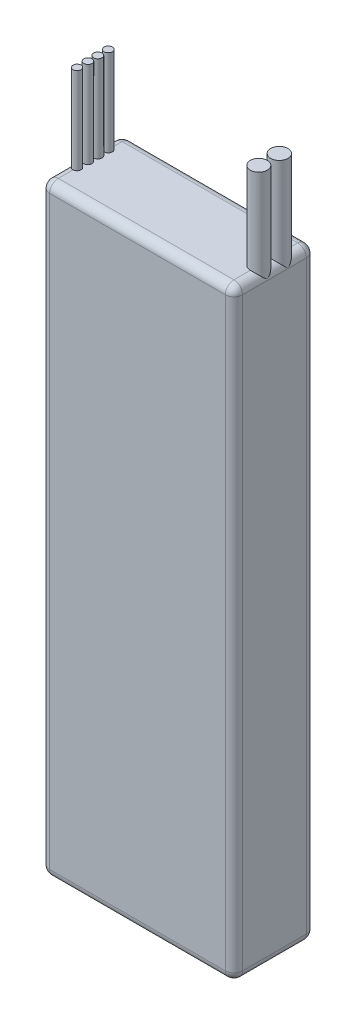
from build123d import *

# Parameters (mm, degrees)
SKETCH1_W                       = 44.5
SKETCH1_H                       = 18.7
BOSS_EXTRUDE1_DEPTH             = 139
FILLET1_R                       = 2
SKETCH2_R                       = 1.960015311
SKETCH2_R_2                     = 1.988264752
SKETCH2_R_3                     = 0.918642691
SKETCH2_R_4                     = 0.97117112
SKETCH2_R_5                     = 0.953860003
SKETCH2_R_6                     = 0.951024876
BOSS_EXTRUDE2_DEPTH             = 20
BOSS_EXTRUDE2_DIRECTION_2_REACH = 149.143


with BuildPart() as part:
    # Sketch1 → Boss-Extrude1 (new body)
    with BuildSketch(Plane(origin=(0, 0, 0), x_dir=(1, 0, 0), z_dir=(0, 1, 0))):
        with Locations((22.25, 9.35)):
            Rectangle(SKETCH1_W, SKETCH1_H)
    extrude(amount=BOSS_EXTRUDE1_DEPTH)

    # Fillet1
    fillet1_edges = [part.edges().sort_by_distance(p)[0] for p in [
        (22.25, 0, -18.7),
        (0, 69.5, -18.7),
        (0, 0, -9.35),
        (22.25, 139, -18.7),
        (0, 139, -9.35),
        (44.5, 139, -9.35),
        (44.5, 69.5, -18.7),
        (44.5, 0, -9.35),
        (0, 69.5, 0),
        (22.25, 139, 0),
        (44.5, 69.5, 0),
        (22.25, 0, 0),
    ]]
    fillet(fillet1_edges, radius=FILLET1_R)

    # Sketch2 → Boss-Extrude2 (add)
    with BuildSketch(Plane(origin=(0, 139, 0), x_dir=(1, 0, 0), z_dir=(0, 1, 0))):
        with Locations((42.5, 7.731273805)):
            Circle(SKETCH2_R)
        with Locations((42.5, 12.467660333)):
            Circle(SKETCH2_R_2)
        with Locations((2, 6.327900019)):
            Circle(SKETCH2_R_3)
        with Locations((2, 11.108141978)):
            Circle(SKETCH2_R_4)
        with Locations((2, 13.520190672)):
            Circle(SKETCH2_R_5)
        with Locations((2, 8.827659575)):
            Circle(SKETCH2_R_6)
    extrude(amount=BOSS_EXTRUDE2_DEPTH)

    # Sketch2 → Boss-Extrude2 direction 2 (add, up to next)
    with BuildSketch(Plane(origin=(0, 139, 0), x_dir=(1, 0, 0), z_dir=(0, 1, 0)), mode=Mode.PRIVATE) as boss_extrude2_direction_2_sk1:
        with Locations((42.5, 7.731273805)):
            Circle(SKETCH2_R)
    boss_extrude2_direction_2_tool1 = extrude(boss_extrude2_direction_2_sk1.sketch, amount=-BOSS_EXTRUDE2_DIRECTION_2_REACH, mode=Mode.PRIVATE) - part.part
    # Sketch2 → Boss-Extrude2 direction 2 (add, up to next)
    with BuildSketch(Plane(origin=(0, 139, 0), x_dir=(1, 0, 0), z_dir=(0, 1, 0)), mode=Mode.PRIVATE) as boss_extrude2_direction_2_sk2:
        with Locations((42.5, 12.467660333)):
            Circle(SKETCH2_R_2)
    boss_extrude2_direction_2_tool2 = extrude(boss_extrude2_direction_2_sk2.sketch, amount=-BOSS_EXTRUDE2_DIRECTION_2_REACH, mode=Mode.PRIVATE) - part.part
    # Sketch2 → Boss-Extrude2 direction 2 (add, up to next)
    with BuildSketch(Plane(origin=(0, 139, 0), x_dir=(1, 0, 0), z_dir=(0, 1, 0)), mode=Mode.PRIVATE) as boss_extrude2_direction_2_sk3:
        with Locations((2, 6.327900019)):
            Circle(SKETCH2_R_3)
    boss_extrude2_direction_2_tool3 = extrude(boss_extrude2_direction_2_sk3.sketch, amount=-BOSS_EXTRUDE2_DIRECTION_2_REACH, mode=Mode.PRIVATE) - part.part
    # Sketch2 → Boss-Extrude2 direction 2 (add, up to next)
    with BuildSketch(Plane(origin=(0, 139, 0), x_dir=(1, 0, 0), z_dir=(0, 1, 0)), mode=Mode.PRIVATE) as boss_extrude2_direction_2_sk4:
        with Locations((2, 11.108141978)):
            Circle(SKETCH2_R_4)
    boss_extrude2_direction_2_tool4 = extrude(boss_extrude2_direction_2_sk4.sketch, amount=-BOSS_EXTRUDE2_DIRECTION_2_REACH, mode=Mode.PRIVATE) - part.part
    # Sketch2 → Boss-Extrude2 direction 2 (add, up to next)
    with BuildSketch(Plane(origin=(0, 139, 0), x_dir=(1, 0, 0), z_dir=(0, 1, 0)), mode=Mode.PRIVATE) as boss_extrude2_direction_2_sk5:
        with Locations((2, 13.520190672)):
            Circle(SKETCH2_R_5)
    boss_extrude2_direction_2_tool5 = extrude(boss_extrude2_direction_2_sk5.sketch, amount=-BOSS_EXTRUDE2_DIRECTION_2_REACH, mode=Mode.PRIVATE) - part.part
    # Sketch2 → Boss-Extrude2 direction 2 (add, up to next)
    with BuildSketch(Plane(origin=(0, 139, 0), x_dir=(1, 0, 0), z_dir=(0, 1, 0)), mode=Mode.PRIVATE) as boss_extrude2_direction_2_sk6:
        with Locations((2, 8.827659575)):
            Circle(SKETCH2_R_6)
    boss_extrude2_direction_2_tool6 = extrude(boss_extrude2_direction_2_sk6.sketch, amount=-BOSS_EXTRUDE2_DIRECTION_2_REACH, mode=Mode.PRIVATE) - part.part
    add(boss_extrude2_direction_2_tool1.solids().sort_by_distance((42.5, 139, -7.731274))[0])
    add(boss_extrude2_direction_2_tool2.solids().sort_by_distance((42.5, 139, -12.46766))[0])
    add(boss_extrude2_direction_2_tool3.solids().sort_by_distance((2, 139, -6.3279))[0])
    add(boss_extrude2_direction_2_tool4.solids().sort_by_distance((2, 139, -11.108142))[0])
    add(boss_extrude2_direction_2_tool5.solids().sort_by_distance((2, 139, -13.520191))[0])
    add(boss_extrude2_direction_2_tool6.solids().sort_by_distance((2, 139, -8.82766))[0])


solid = part.part
